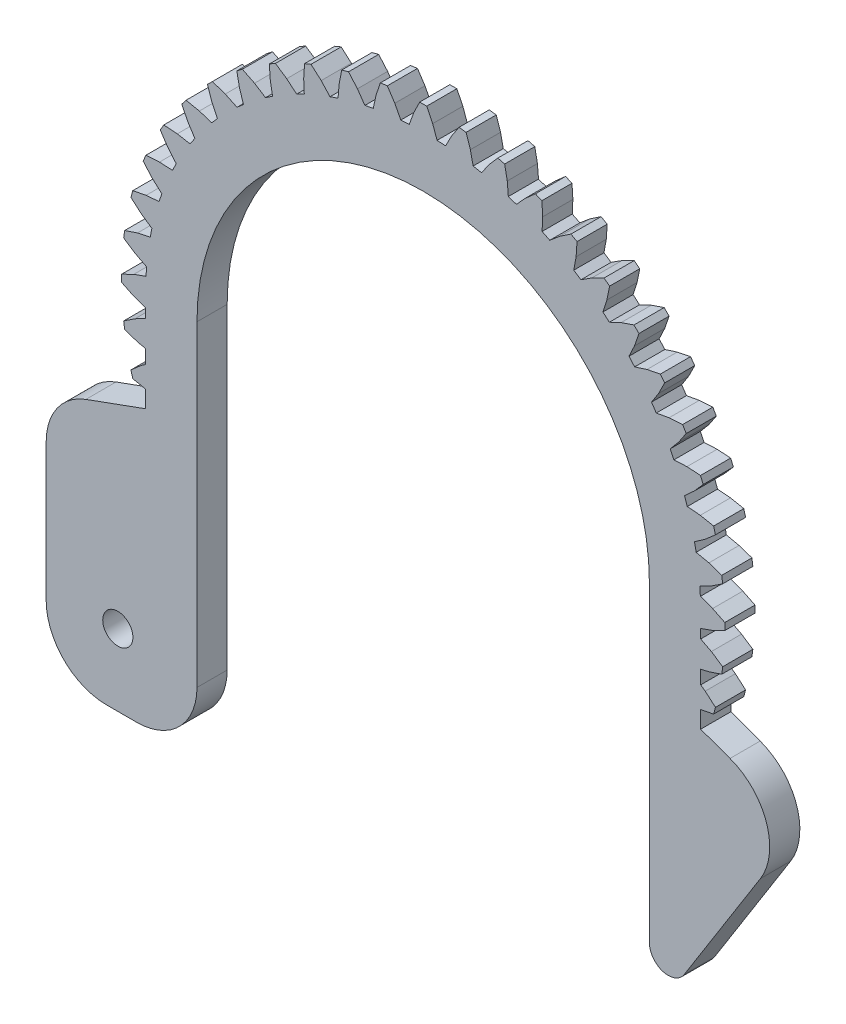
from build123d import *

# Parameters (mm, degrees)
BOSS_EXTRUDE1_DEPTH = 4
BOSS_EXTRUDE2_DEPTH = 4
CUT_EXTRUDE1_REACH  = 145.347
SKETCH3_R           = 2
CUT_EXTRUDE2_REACH  = 145.347
SKETCH4_R           = 30
CUT_EXTRUDE3_REACH  = 145.347
SKETCH5_W           = 60
SKETCH5_H           = 50
FILLET1_R           = 8
FILLET2_R           = 2.5


with BuildPart() as part:
    # Sketch1 → Boss-Extrude1 (new body)
    with BuildSketch(Plane.XY):
        Polygon((83.883520985, 67.190967342), (85.509218504, 66.606087932), (87.12712424, 65.81384946), (87.12712424, 64.885382569), (85.509218504, 64.093144098), (83.883520985, 63.508265133), (83.809500373, 62.377590807), (85.344838937, 61.585478354), (86.845618103, 60.588770789), (86.724344494, 59.668346829), (85.016834133, 59.094024044), (83.328803678, 58.726306881), (83.107745985, 57.61498644), (84.526586737, 56.62933824), (85.884350286, 55.445253367), (85.644065171, 54.54845546), (83.876106366, 54.20197712), (82.154521099, 54.057704879), (81.790322662, 52.984840175), (83.068410345, 51.822245717), (84.26003541, 50.47114201), (83.904759808, 49.613428596), (82.10663979, 49.500574638), (80.380907485, 49.582261906), (79.879851871, 48.566075327), (80.995193776, 47.246767067), (82.000320992, 45.751643157), (81.536087769, 44.947591436), (79.738721637, 45.070373261), (78.038375193, 45.376636948), (77.408882499, 44.434597), (78.342627925, 42.980945258), (79.143914805, 41.367438153), (78.578766001, 40.630872329), (76.812818597, 40.987278982), (75.167013305, 41.512840999), (74.419891302, 40.660907968), (75.155828814, 39.09792144), (75.739702301, 37.393553086), (75.083189955, 36.73704074), (73.3788216, 37.320914227), (71.815835072, 38.056851738), (70.963902042, 37.309729735), (71.489463613, 35.663924443), (71.845870712, 33.897977039), (71.109304888, 33.332828236), (69.495797783, 34.134115116), (68.042146041, 35.067860542), (67.100106093, 34.438367848), (67.406369334, 32.738021404), (67.529151605, 30.940655272), (66.725099884, 30.476421604), (65.229975973, 31.481549264), (63.910667714, 32.59689117), (62.894481135, 32.095835556), (62.976168402, 30.370102805), (62.863314444, 28.571983233), (62.005600586, 28.216707631), (60.654497323, 29.408332695), (59.491902866, 30.686420378), (58.419037716, 30.322221941), (58.274765921, 28.600636675), (57.92828758, 26.83267787), (57.031489674, 26.592392309), (55.847404801, 27.950156304), (54.8617566, 29.368997056), (53.75043616, 29.147939363), (53.382718997, 27.459908462), (52.808396211, 25.752398547), (51.887972251, 25.631124938), (50.891264687, 27.131903658), (50.099152234, 28.667242668), (48.968477907, 28.593221611), (48.383598943, 26.967524536), (47.591360471, 25.349618801), (46.662893135, 25.349618801), (45.870655109, 26.967524536), (45.285775699, 28.593221611), (44.155101818, 28.667242668), (43.362988919, 27.131903658), (42.3662818, 25.631124938), (41.445857395, 25.752398547), (40.871535055, 27.459908462), (40.503817892, 29.147939363), (39.392497006, 29.368997056), (38.406849251, 27.950156304), (37.222764378, 26.592392309), (36.325966471, 26.83267787), (35.979487686, 28.600636675), (35.83521589, 30.322221941), (34.762351186, 30.686420378), (33.599756283, 29.408332695), (32.248653021, 28.216707631), (31.390939607, 28.571983233), (31.278085649, 30.370102805), (31.359772471, 32.095835556), (30.343586338, 32.59689117), (29.024278078, 31.481549264), (27.529154168, 30.476421604), (26.725102447, 30.940655272), (26.847884272, 32.738021404), (27.154147959, 34.438367848), (26.212108011, 35.067860542), (24.758456269, 34.134115116), (23.144948718, 33.332828236), (22.40838334, 33.897977039), (22.764789993, 35.663924443), (23.29035201, 37.309729735), (22.438418979, 38.056851738), (20.875432006, 37.320914227), (19.171064097, 36.73704074), (18.514551751, 37.393553086), (19.098425238, 39.09792144), (19.834362304, 40.660907968), (19.087240301, 41.512840999), (17.441435454, 40.987278982), (15.675487605, 40.630872329), (15.110339247, 41.367438153), (15.911626127, 42.980945258), (16.845371553, 44.434597), (16.215878859, 45.376636948), (14.51553197, 45.070373261), (12.718166283, 44.947591436), (12.253932615, 45.751643157), (13.259060275, 47.246767067), (14.374402181, 48.566075327), (13.873346567, 49.582261906), (12.147613816, 49.500574638), (10.349494244, 49.613428596), (9.994218197, 50.47114201), (11.185843706, 51.822245717), (12.463931389, 52.984840175), (12.099732952, 54.057704879), (10.37814724, 54.20197712), (8.610188881, 54.54845546), (8.36990332, 55.445253367), (9.727667315, 56.62933824), (11.146508067, 57.61498644), (10.925450374, 58.726306881), (9.237419473, 59.094024044), (7.529909558, 59.668346829), (7.408635504, 60.588770789), (8.909414669, 61.585478354), (10.444753679, 62.377590807), (10.370732622, 63.508265133), (8.745035547, 64.093144098), (7.127129812, 64.885382569), (7.127129812, 65.81384946), (8.745035547, 66.606087932), (10.370732622, 67.190967342), (10.444753679, 68.321641223), (8.909414669, 69.113754121), (7.408635504, 70.11046124), (7.529909558, 71.030885646), (9.237419473, 71.605207986), (10.925450374, 71.972925149), (11.146508067, 73.084245589), (9.727667315, 74.06989379), (8.36990332, 75.253978663), (8.610188881, 76.150776569), (10.37814724, 76.497255355), (12.099732952, 76.64152715), (12.463931389, 77.714391855), (11.185843706, 78.876986758), (9.994218197, 80.22809002), (10.349494244, 81.085803434), (12.147613816, 81.198657391), (13.873346567, 81.116970124), (14.374402181, 82.133156703), (13.259060275, 83.452464962), (12.253932615, 84.947588873), (12.718166283, 85.751640594), (14.51553197, 85.628858769), (16.215878859, 85.322595082), (16.845371553, 86.26463503), (15.911626127, 87.718286772), (15.110339247, 89.331793877), (15.675487605, 90.068359701), (17.441435454, 89.711953048), (19.087240301, 89.186391031), (19.834362304, 90.038324061), (19.098425238, 91.601311035), (18.514551751, 93.305678944), (19.171064097, 93.96219129), (20.875432006, 93.378317803), (22.438418979, 92.642380291), (23.29035201, 93.38950274), (22.764789993, 95.035307586), (22.40838334, 96.801254991), (23.144948718, 97.366403794), (24.758456269, 96.565116914), (26.212108011, 95.631371488), (27.154147959, 96.260864182), (26.847884272, 97.961211071), (26.725102447, 99.758576758), (27.529154168, 100.222810426), (29.024278078, 99.217682765), (30.343586338, 98.10234086), (31.359772471, 98.603396474), (31.278085649, 100.329129224), (31.390939607, 102.127248797), (32.248653021, 102.482524399), (33.599756283, 101.290899334), (34.762351186, 100.012811651), (35.83521589, 100.377010088), (35.979487686, 102.0985958), (36.325966471, 103.86655416), (37.222764378, 104.106839721), (38.406849251, 102.749075726), (39.392497006, 101.330234974), (40.503817892, 101.551292667), (40.871535055, 103.239323568), (41.445857395, 104.946833483), (42.3662818, 105.068107092), (43.362988919, 103.567328371), (44.155101818, 102.031989362), (45.285775699, 102.106010419), (45.870655109, 103.731707493), (46.662893135, 105.349613229), (47.591360471, 105.349613229), (48.383598943, 103.731707493), (48.968477907, 102.106010419), (50.099152234, 102.031989362), (50.891264687, 103.567328371), (51.887972251, 105.068107092), (52.808396211, 104.946833483), (53.382718997, 103.239323568), (53.75043616, 101.551292667), (54.8617566, 101.330234974), (55.847404801, 102.749075726), (57.031489674, 104.106839721), (57.92828758, 103.86655416), (58.274765921, 102.0985958), (58.419037716, 100.377010088), (59.491902866, 100.012811651), (60.654497323, 101.290899334), (62.005600586, 102.482524399), (62.863314444, 102.127248797), (62.976168402, 100.329129224), (62.894481135, 98.603396474), (63.910667714, 98.10234086), (65.229975973, 99.217682765), (66.725099884, 100.222810426), (67.529151605, 99.758576758), (67.406369334, 97.961211071), (67.100106093, 96.260864182), (68.042146041, 95.631371488), (69.495797783, 96.565116914), (71.109304888, 97.366403794), (71.845870712, 96.801254991), (71.489463613, 95.035307586), (70.963902042, 93.38950274), (71.815835072, 92.642380291), (73.3788216, 93.378317803), (75.083189955, 93.96219129), (75.739702301, 93.305678944), (75.155828814, 91.601311035), (74.419891302, 90.038324061), (75.167013305, 89.186391031), (76.812818597, 89.711953048), (78.578766001, 90.068359701), (79.143914805, 89.331793877), (78.342627925, 87.718286772), (77.408882499, 86.26463503), (78.038375193, 85.322595082), (79.738721637, 85.628858769), (81.536087769, 85.751640594), (82.000320992, 84.947588873), (80.995193776, 83.452464962), (79.879851871, 82.133156703), (80.380907485, 81.116970124), (82.10663979, 81.198657391), (83.904759808, 81.085803434), (84.26003541, 80.22809002), (83.068410345, 78.876986758), (81.790322662, 77.714391855), (82.154521099, 76.64152715), (83.876106366, 76.497255355), (85.644065171, 76.150776569), (85.884350286, 75.253978663), (84.526586737, 74.06989379), (83.107745985, 73.084245589), (83.328803678, 71.972925149), (85.016834133, 71.605207986), (86.724344494, 71.030885646), (86.845618103, 70.11046124), (85.344838937, 69.113754121), (83.809500373, 68.321641223), align=None)
    extrude(amount=BOSS_EXTRUDE1_DEPTH)

    # Sketch2 → Boss-Extrude2 (add)
    with BuildSketch(Plane.XY):
        Polygon((10.327126803, 51.955511394), (-2.872873197, 47.151104302), (-2.872873197, 15.349616015), (77.127126803, 15.349616015), (97.127126803, 47.151104302), (83.927126803, 51.955511394), (83.927126803, 65.349616015), (10.327126803, 65.349616015), align=None)
    extrude(amount=BOSS_EXTRUDE2_DEPTH)

    # Sketch3 → Cut-Extrude1 (cut, up to next)
    with BuildSketch(Plane.XY, mode=Mode.PRIVATE) as cut_extrude1_sk1:
        with Locations((6.627126803, 24.849616015)):
            Circle(SKETCH3_R)
    cut_extrude1_tool1 = extrude(cut_extrude1_sk1.sketch, amount=CUT_EXTRUDE1_REACH, mode=Mode.PRIVATE) & part.part
    add(cut_extrude1_tool1.solids().sort_by_distance((6.627127, 24.849616, 0))[0], mode=Mode.SUBTRACT)

    # Sketch4 → Cut-Extrude2 (cut, up to next)
    with BuildSketch(Plane.XY, mode=Mode.PRIVATE) as cut_extrude2_sk1:
        with Locations((47.127126803, 65.349616015)):
            Circle(SKETCH4_R)
    cut_extrude2_tool1 = extrude(cut_extrude2_sk1.sketch, amount=CUT_EXTRUDE2_REACH, mode=Mode.PRIVATE) & part.part
    add(cut_extrude2_tool1.solids().sort_by_distance((47.127127, 65.349616, 0))[0], mode=Mode.SUBTRACT)

    # Sketch5 → Cut-Extrude3 (cut, up to next)
    with BuildSketch(Plane.XY, mode=Mode.PRIVATE) as cut_extrude3_sk1:
        with Locations((47.127126803, 40.349616015)):
            Rectangle(SKETCH5_W, SKETCH5_H)
    cut_extrude3_tool1 = extrude(cut_extrude3_sk1.sketch, amount=CUT_EXTRUDE3_REACH, mode=Mode.PRIVATE) & part.part
    add(cut_extrude3_tool1.solids().sort_by_distance((47.127127, 40.349616, 0))[0], mode=Mode.SUBTRACT)

    # Fillet1
    fillet1_edges = [part.edges().sort_by_distance(p)[0] for p in [
        (17.127126803, 15.349616015, 2),
        (-2.872873197, 15.349616015, 2),
        (-2.872873197, 47.151104302, 2),
        (97.127126803, 47.151104302, 2),
    ]]
    fillet(fillet1_edges, radius=FILLET1_R)

    # Fillet2
    fillet2_edges = [part.edges().sort_by_distance(p)[0] for p in [
        (77.127126803, 15.349616015, 2),
    ]]
    fillet(fillet2_edges, radius=FILLET2_R)


solid = part.part
